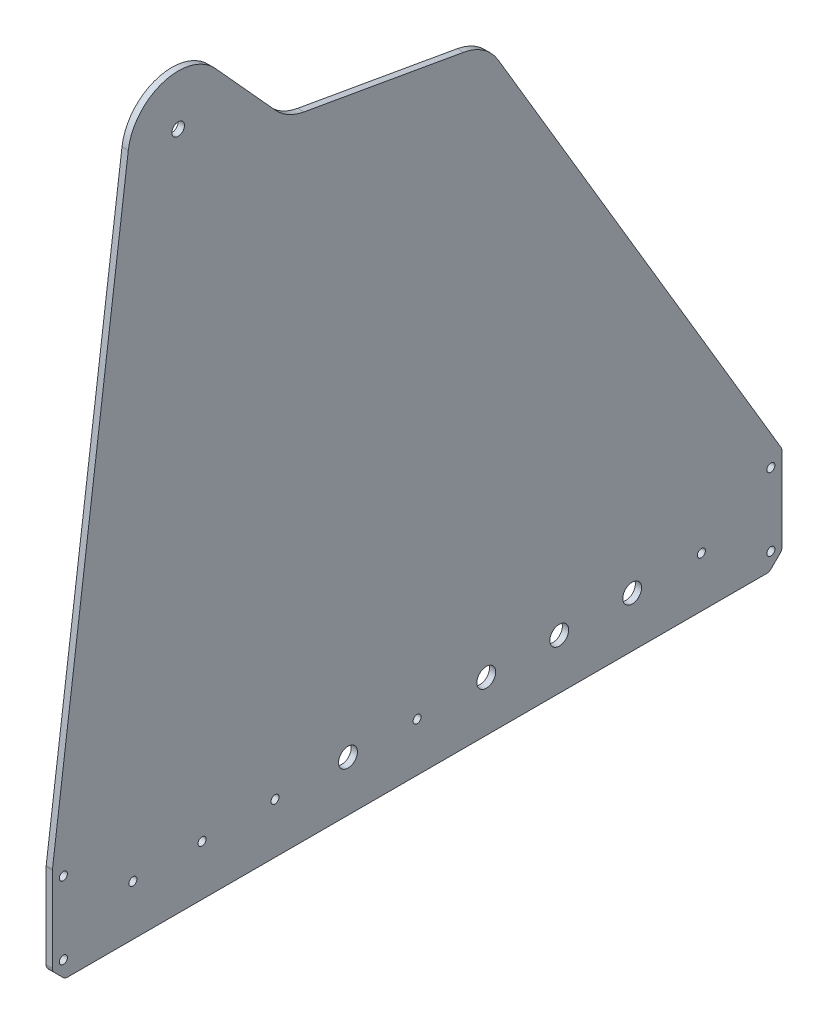
from build123d import *

# Parameters (mm, degrees)
PLATE_DEPTH                  = 3.175
F_3_8_0_375_DIAMETER_HOLE1_D = 9.525
F_8_CLEARANCE_HOLE1_D        = 4.064
SKETCH3_R                    = 3.175
TUBE_PIVOT_HOLES_DEPTH       = 521.864531932
BOTTOM_CORNER_CHAMFER_SIZE   = 6.35
BOTTOM_CORNER_FILLET_R       = 3.175
CARBON_CAP_HOLES_D           = 4.064


with BuildPart() as part:
    # Sketch2 → Plate (new body)
    with BuildSketch(Plane(origin=(0, 0, 0), x_dir=(0, 0, -1), z_dir=(1, 0, 0))):
        with BuildLine():
            Line((0, 0), (0, 50.8))
            Line((0, 50.8), (38.311002826, 346.167173299))
            ThreePointArc((38.311002826, 346.167173299), (55.900445741, 367.136476127), (82.313788673, 359.96462293))
            Line((82.313788673, 359.96462293), (112.596875039, 326.577445868))
            ThreePointArc((112.596875039, 326.577445868), (119.137016705, 321.404317358), (127, 318.627951872))
            Line((127, 318.627951872), (207.610663713, 304.414116927))
            ThreePointArc((207.610663713, 304.414116927), (217.646994771, 300.291250372), (225.047101529, 292.356239993))
            Line((225.047101529, 292.356239993), (368.3, 50.8))
            Line((368.3, 50.8), (368.3, 0))
            Line((368.3, 0), (0, 0))
        make_face()
    extrude(amount=PLATE_DEPTH)

    # 3/8 (0.375) Diameter Hole1 (through all)
    with Locations(Plane(origin=(3.175, 0, 0), x_dir=(0, 0, -1), z_dir=(1, 0, 0))):
        with Locations((149.234021051, 25.4), (219.065978949, 25.4), (255.895978949, 25.4), (292.725978949, 25.4)):
            Hole(F_3_8_0_375_DIAMETER_HOLE1_D / 2)

    # #8 Clearance Hole1 (through all)
    with Locations(Plane(origin=(3.175, 0, 0), x_dir=(0, 0, -1), z_dir=(1, 0, 0))):
        with Locations((184.15, 24.60625), (327.650978949, 25.4), (112.404021051, 25.4), (75.574021051, 25.4), (40.649021051, 25.4)):
            Hole(F_8_CLEARANCE_HOLE1_D / 2)

    # Sketch3 → Tube Pivot Holes (cut, through all)
    with BuildSketch(Plane(origin=(3.175, 0, 0), x_dir=(0, 0, -1), z_dir=(1, 0, 0))):
        with Locations((63.5, 342.9)):
            Circle(SKETCH3_R)
    extrude(amount=-TUBE_PIVOT_HOLES_DEPTH, mode=Mode.SUBTRACT)

    # Bottom Corner Chamfer
    bottom_corner_chamfer_edges = [part.edges().sort_by_distance(p)[0] for p in [
        (1.5875, 0, -368.3),
        (1.5875, 0, 0),
    ]]
    chamfer(bottom_corner_chamfer_edges, length=BOTTOM_CORNER_CHAMFER_SIZE)

    # Bottom Corner Fillet
    bottom_corner_fillet_edges = [part.edges().sort_by_distance(p)[0] for p in [
        (1.5875, 50.8, 0),
        (1.5875, 0, -6.35),
        (1.5875, 6.35, 0),
        (1.5875, 0, -361.95),
        (1.5875, 6.35, -368.3),
        (1.5875, 50.8, -368.3),
    ]]
    fillet(bottom_corner_fillet_edges, radius=BOTTOM_CORNER_FILLET_R)

    # Carbon Cap Holes (through all)
    with Locations(Plane(origin=(3.175, 0, 0), x_dir=(0, 0, -1), z_dir=(1, 0, 0))):
        with Locations((5.55625, 45.24375), (5.55625, 8.651474106), (362.74375, 45.24375), (362.74375, 8.651474106)):
            Hole(CARBON_CAP_HOLES_D / 2)


solid = part.part
